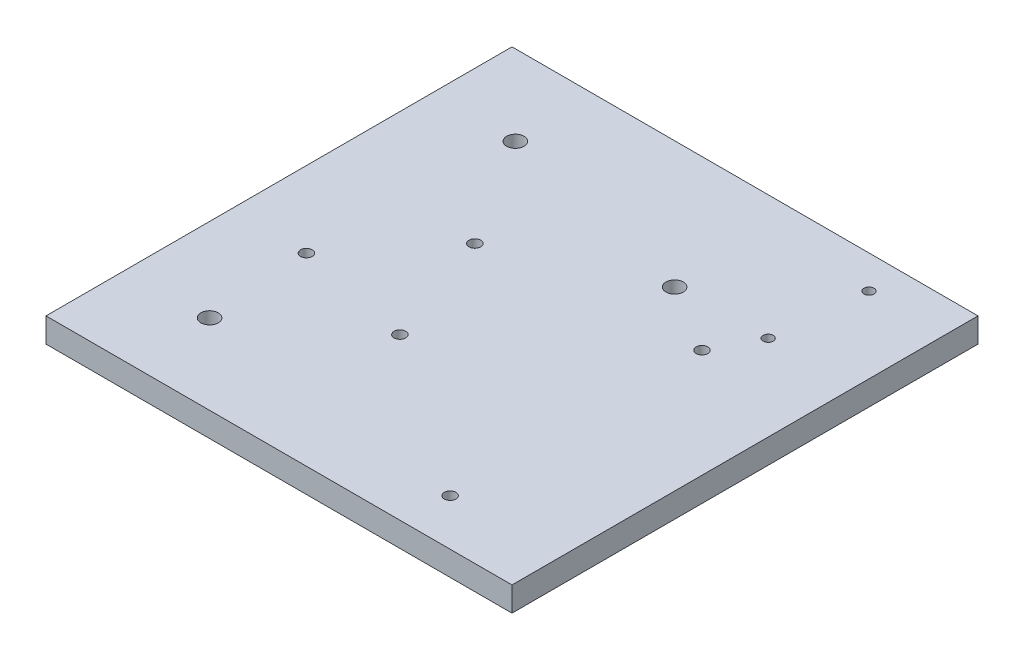
from build123d import *

# Parameters (mm, degrees)
SKETCH1_W           = 101.6
SKETCH1_H           = 101.6
BOSS_EXTRUDE1_DEPTH = 5.334
SKETCH3_R           = 1.27
CUT_EXTRUDE2_DEPTH  = 73.039791477
SKETCH4_R           = 1.27
CUT_EXTRUDE3_DEPTH  = 73.039791477
SKETCH7_R           = 1.89865
CUT_EXTRUDE5_DEPTH  = 73.039791477
SKETCH8_R           = 1.89865
CUT_EXTRUDE6_DEPTH  = 73.039791477
SKETCH10_R          = 1.1
CUT_EXTRUDE7_DEPTH  = 73.039791477


with BuildPart() as part:
    # Sketch1 → Boss-Extrude1 (new body)
    with BuildSketch(Plane(origin=(0, 0, 0), x_dir=(1, 0, 0), z_dir=(0, 1, 0))):
        Rectangle(SKETCH1_W, SKETCH1_H)
    extrude(amount=BOSS_EXTRUDE1_DEPTH)

    # Sketch3 → Cut-Extrude2 (cut, through all)
    with BuildSketch(Plane.XZ):
        with Locations((-8.691546024, 15.75616758)):
            Circle(SKETCH3_R)
        with Locations((-34.262562923, 10.563822948)):
            Circle(SKETCH3_R)
        with Locations((-17.714931052, -9.610745883)):
            Circle(SKETCH3_R)
    extrude(amount=-CUT_EXTRUDE2_DEPTH, mode=Mode.SUBTRACT)

    # Sketch4 → Cut-Extrude3 (cut, through all)
    with BuildSketch(Plane.XZ):
        with Locations((27.2, 40.690822948)):
            Circle(SKETCH4_R)
        with Locations((27.2, -14.229177052)):
            Circle(SKETCH4_R)
    extrude(amount=-CUT_EXTRUDE3_DEPTH, mode=Mode.SUBTRACT)

    # Sketch7 → Cut-Extrude5 (cut, through all)
    with BuildSketch(Plane.XZ):
        with Locations((-32.600738686, -33.3375)):
            Circle(SKETCH7_R)
        with Locations((-32.600738686, 33.3375)):
            Circle(SKETCH7_R)
    extrude(amount=-CUT_EXTRUDE5_DEPTH, mode=Mode.SUBTRACT)

    # Sketch8 → Cut-Extrude6 (cut, through all)
    with BuildSketch(Plane(origin=(0, 5.334, 0), x_dir=(1, 0, 0), z_dir=(0, 1, 0))):
        with Locations((12.280738686, 23.1775)):
            Circle(SKETCH8_R)
    extrude(amount=-CUT_EXTRUDE6_DEPTH, mode=Mode.SUBTRACT)

    # Sketch10 → Cut-Extrude7 (cut, through all)
    with BuildSketch(Plane(origin=(0, 5.334, 0), x_dir=(1, 0, 0), z_dir=(0, 1, 0))):
        with Locations((34.238748138, 43.589855351)):
            Circle(SKETCH10_R)
        with Locations((32.148178872, 23.699417444)):
            Circle(SKETCH10_R)
    extrude(amount=-CUT_EXTRUDE7_DEPTH, mode=Mode.SUBTRACT)


solid = part.part
